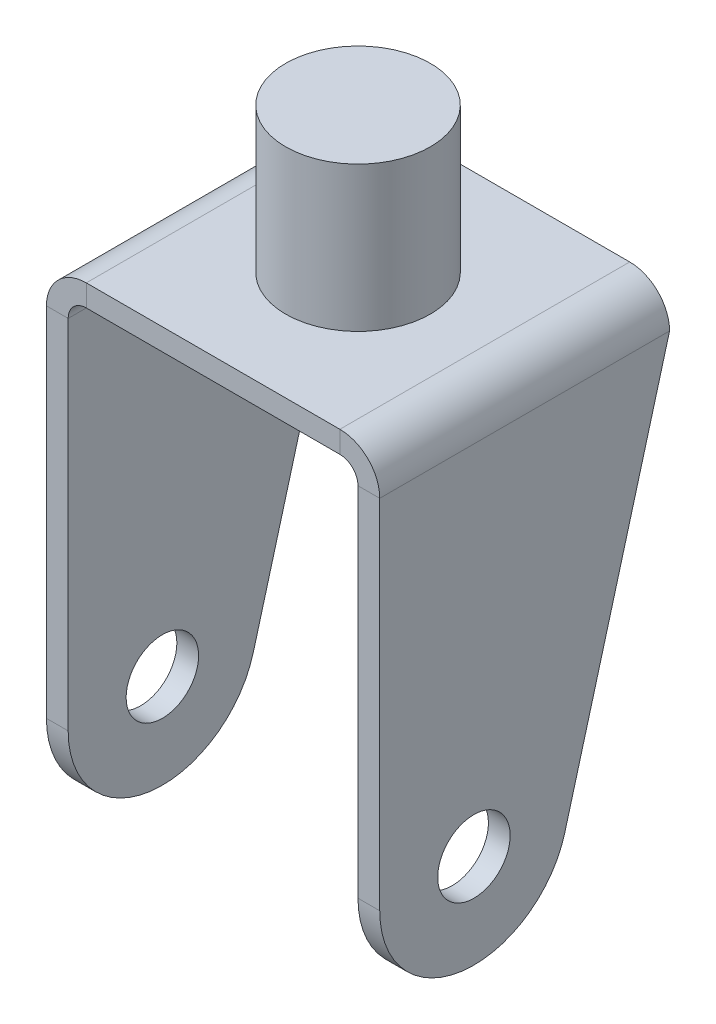
from build123d import *

# Parameters (mm, degrees)
BASE_FLANGE1_DEPTH  = 50.8
SKETCH8_R           = 12.7
CUT_EXTRUDE2_DEPTH  = 215.217642934
SKETCH9_R           = 25.36182522
BOSS_EXTRUDE1_DEPTH = 50.8


# Sheet-metal steps are written as plain solids
with BuildPart() as part:
    # Sketch2 → Base-Flange1 (new, symmetric)
    with BuildSketch(Plane.XY):
        with BuildLine():
            Line((50.8, 0), (50.8, 158.242))
            ThreePointArc((50.8, 158.242), (48.940128061, 162.732128061), (44.45, 164.592))
            Line((44.45, 164.592), (-44.45, 164.592))
            ThreePointArc((-44.45, 164.592), (-48.940128061, 162.732128061), (-50.8, 158.242))
            Line((-50.8, 158.242), (-50.8, 0))
            Line((-50.8, 0), (-58.42, 0))
            Line((-58.42, 0), (-58.42, 158.242))
            ThreePointArc((-58.42, 158.242), (-54.328281733, 168.120281733), (-44.45, 172.212))
            Line((-44.45, 172.212), (44.45, 172.212))
            ThreePointArc((44.45, 172.212), (54.328281733, 168.120281733), (58.42, 158.242))
            Line((58.42, 158.242), (58.42, 0))
            Line((58.42, 0), (50.8, 0))
        make_face()
    extrude(amount=BASE_FLANGE1_DEPTH, both=True)

    # Sketch8 → Cut-Extrude2 (cut, through all)
    with BuildSketch(Plane(origin=(58.42, 0, 0), x_dir=(0, 0, -1), z_dir=(1, 0, 0))):
        with BuildLine():
            Line((50.8, 0), (50.8, 158.242))
            Line((50.8, 158.242), (14.064244739, 24.287046492))
            ThreePointArc((14.064244739, 24.287046492), (2.244463478, 6.764690776), (-17.78, 0))
            Line((-17.78, 0), (50.8, 0))
        make_face()
        with BuildLine():
            Line((-50.8, 0), (-17.78, 0))
            ThreePointArc((-17.78, 0), (-41.128665915, 9.671334085), (-50.8, 33.02))
            Line((-50.8, 33.02), (-50.8, 0))
        make_face()
        with Locations((-17.78, 33.02)):
            Circle(SKETCH8_R)
    extrude(amount=-CUT_EXTRUDE2_DEPTH, mode=Mode.SUBTRACT)

    # Sketch9 → Boss-Extrude1 (add)
    with BuildSketch(Plane(origin=(0, 172.212, 0), x_dir=(1, 0, 0), z_dir=(0, 1, 0))):
        with Locations(Location((0, 0, 0), (0, 0, 270))):
            Circle(SKETCH9_R)
    extrude(amount=BOSS_EXTRUDE1_DEPTH)


solid = part.part
